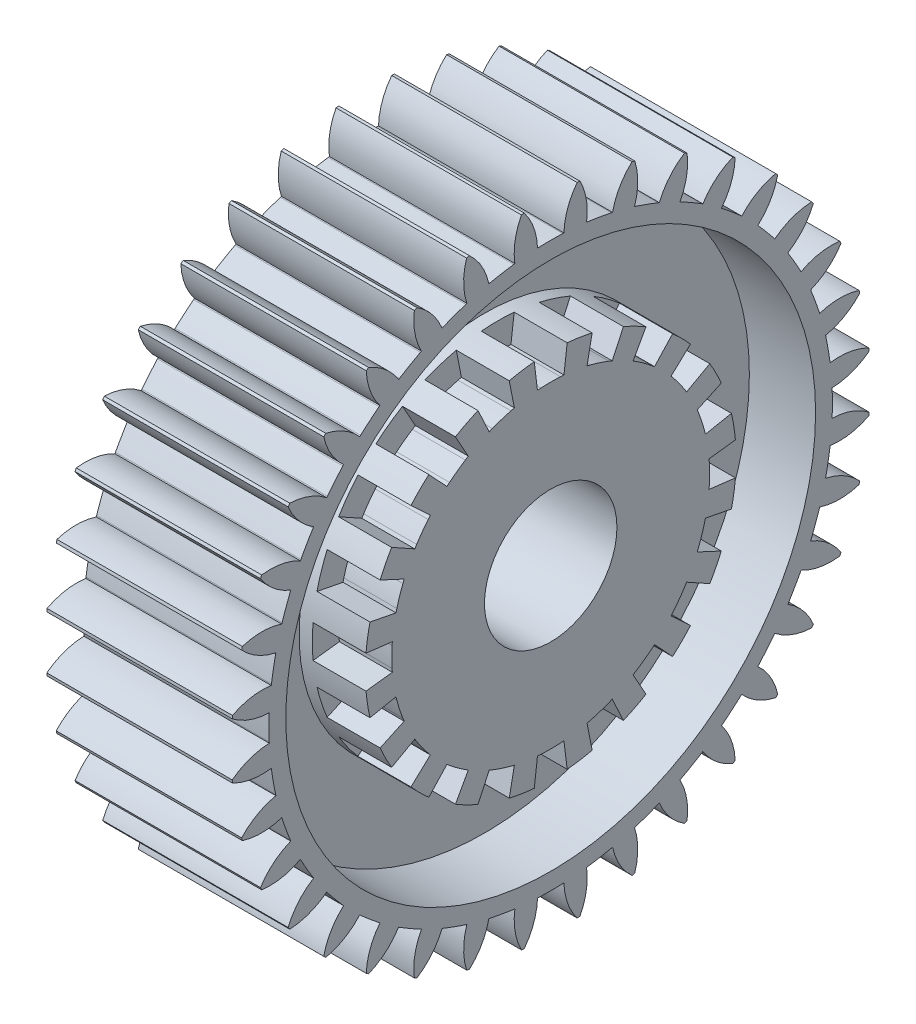
from build123d import *

# Parameters (mm, degrees)
SKETCH1_R                = 120.65
BOSS_EXTRUDE1_DEPTH      = 35
SKETCH2_R                = 25
CUT_EXTRUDE1_DEPTH       = 185.425716753
SKETCH3_R                = 100
SKETCH3_R_2              = 70
CUT_EXTRUDE2_DEPTH       = 25
CUT_EXTRUDE5_DEPTH       = 185.425716753
FILLET1_R                = 150
CIRPATTERN1_COUNT        = 36
FILLET1_OF_CIRPATTERN1_R = 150
CUT_EXTRUDE6_DEPTH       = 20
FILLET2_R                = 60
CIRPATTERN2_COUNT        = 20
FILLET2_OF_CIRPATTERN2_R = 60


with BuildPart() as part:
    # Sketch1 → Boss-Extrude1 (new, symmetric)
    with BuildSketch(Plane(origin=(0, 0, 0), x_dir=(0, 0, -1), z_dir=(1, 0, 0))):
        Circle(SKETCH1_R)
    extrude(amount=BOSS_EXTRUDE1_DEPTH, both=True)

    # Sketch2 → Cut-Extrude1 (cut, through all)
    with BuildSketch(Plane(origin=(35, 0, 0), x_dir=(0, 0, -1), z_dir=(1, 0, 0))):
        Circle(SKETCH2_R)
    extrude(amount=-CUT_EXTRUDE1_DEPTH, mode=Mode.SUBTRACT)

    # Sketch3 → Cut-Extrude2 (cut)
    with BuildSketch(Plane(origin=(35, 0, 0), x_dir=(0, 0, -1), z_dir=(1, 0, 0))):
        Circle(SKETCH3_R)
        Circle(SKETCH3_R_2, mode=Mode.SUBTRACT)
    extrude(amount=-CUT_EXTRUDE2_DEPTH, mode=Mode.SUBTRACT)

    # Sketch4 → Cut-Extrude5 (cut, through all)
    with BuildSketch(Plane(origin=(35, 0, 0), x_dir=(0, 0, -1), z_dir=(1, 0, 0))):
        with BuildLine():
            Line((0, 106.400245758), (-4.985, 106.248119983))
            ThreePointArc((-4.985, 106.248119983), (-6.379447104, 113.635112256), (-9.975, 120.236940559))
            Line((-9.975, 120.236940559), (0, 138.618178177))
            Line((0, 138.618178177), (9.975, 120.236940559))
            ThreePointArc((9.975, 120.236940559), (6.379447104, 113.635112256), (4.985, 106.248119983))
            Line((4.985, 106.248119983), (0, 106.400245758))
        make_face()
    cut_extrude5 = extrude(amount=-CUT_EXTRUDE5_DEPTH, mode=Mode.SUBTRACT)

    # Fillet1
    # the kernel refuses this fillet: 150 mm, written as the material it takes off along each edge
    with BuildSketch(Plane(origin=(46.443764402, 106.400245758, 0), x_dir=(0, -0.03050250535302991, -0.9995346903270483), z_dir=(-1, 0, 0))) as fillet1_piece_1:
        with BuildLine():
            CenterArc((FILLET1_R * 0.0305167050711, FILLET1_R), FILLET1_R, 266.50412812, 3.49587188)
            Line((-FILLET1_R * 0.0304599194134, FILLET1_R * 0.00186080566562), (0, 0))
            Line((0, 0), (FILLET1_R * 0.0305167050711, 0))
        make_face()
    extrude(amount=92.887528803, mode=Mode.SUBTRACT)

    # CirPattern1: Cut-Extrude5 ×36 about axis
    cirpattern1_axis = Axis((0, 0, 0), (1, 0, 0))
    for i in range(1, CIRPATTERN1_COUNT):
        add(cut_extrude5.rotate(cirpattern1_axis, i * 360 / CIRPATTERN1_COUNT), mode=Mode.SUBTRACT)

    # Fillet1 of CirPattern1
    # the kernel refuses this fillet: 150 mm, written as the material it takes off along each edge
    with BuildSketch(Plane(origin=(46.443764402, 104.783786945, 18.476208779), x_dir=(0, -0.2036064812481332, 0.979052807969904), z_dir=(-1, 0, 0)), Plane(origin=(46.443764402, 99.983525789, 36.391027304), x_dir=(0, -0.3705239772403646, 0.9288229014672182), z_dir=(-1, 0, 0)), Plane(origin=(46.443764402, 92.145315795, 53.200122879), x_dir=(0, -0.5261832896783177, 0.8503711811105216), z_dir=(-1, 0, 0)), Plane(origin=(46.443764402, 81.50731701, 68.392759641), x_dir=(0, -0.6658547891209932, 0.7460813627243599), z_dir=(-1, 0, 0)), Plane(origin=(46.443764402, 68.392759641, 81.50731701), x_dir=(0, -0.7852946277350107, 0.6191222396672009), z_dir=(-1, 0, 0)), Plane(origin=(46.443764402, 53.200122879, 92.145315795), x_dir=(0, -0.8808736864635514, 0.47335140064872827), z_dir=(-1, 0, 0)), Plane(origin=(46.443764402, 36.391027304, 99.983525789), x_dir=(0, -0.949687843972491, 0.31319801884890963), z_dir=(-1, 0, 0)), Plane(origin=(46.443764402, 18.476208779, 104.783786945), x_dir=(0, -0.989646216907564, 0.14352827373220522), z_dir=(-1, 0, 0)), Plane(origin=(46.443764402, 0, 106.400245758), x_dir=(0, -0.9995346903270483, -0.030502505353029917), z_dir=(-1, 0, 0)), Plane(origin=(46.443764402, -18.476208779, 104.783786945), x_dir=(0, -0.9790528079699027, -0.20360648124813913), z_dir=(-1, 0, 0)), Plane(origin=(46.443764402, -36.391027304, 99.983525789), x_dir=(0, -0.9288229014672182, -0.3705239772403646), z_dir=(-1, 0, 0)), Plane(origin=(46.443764402, -53.200122879, 92.145315795), x_dir=(0, -0.8503711811105207, -0.5261832896783193), z_dir=(-1, 0, 0)), Plane(origin=(46.443764402, -68.392759641, 81.50731701), x_dir=(0, -0.746081362724357, -0.6658547891209964), z_dir=(-1, 0, 0)), Plane(origin=(46.443764402, -81.50731701, 68.392759641), x_dir=(0, -0.6191222396672028, -0.7852946277350092), z_dir=(-1, 0, 0)), Plane(origin=(46.443764402, -92.145315795, 53.200122879), x_dir=(0, -0.4733514006487301, -0.8808736864635505), z_dir=(-1, 0, 0)), Plane(origin=(46.443764402, -99.983525789, 36.391027304), x_dir=(0, -0.31319801884890963, -0.949687843972491), z_dir=(-1, 0, 0)), Plane(origin=(46.443764402, -104.783786945, 18.476208779), x_dir=(0, -0.14352827373220864, -0.9896462169075634), z_dir=(-1, 0, 0)), Plane(origin=(46.443764402, -106.400245758, 0), x_dir=(0, 0.030502505353029917, -0.9995346903270483), z_dir=(-1, 0, 0)), Plane(origin=(46.443764402, -104.783786945, -18.476208779), x_dir=(0, 0.20360648124813913, -0.9790528079699027), z_dir=(-1, 0, 0)), Plane(origin=(46.443764402, -99.983525789, -36.391027304), x_dir=(0, 0.3705239772403657, -0.9288229014672178), z_dir=(-1, 0, 0)), Plane(origin=(46.443764402, -92.145315795, -53.200122879), x_dir=(0, 0.5261832896783177, -0.8503711811105216), z_dir=(-1, 0, 0)), Plane(origin=(46.443764402, -81.50731701, -68.392759641), x_dir=(0, 0.6658547891209933, -0.7460813627243597), z_dir=(-1, 0, 0)), Plane(origin=(46.443764402, -68.392759641, -81.50731701), x_dir=(0, 0.7852946277350092, -0.6191222396672028), z_dir=(-1, 0, 0)), Plane(origin=(46.443764402, -53.200122879, -92.145315795), x_dir=(0, 0.8808736864635501, -0.4733514006487307), z_dir=(-1, 0, 0)), Plane(origin=(46.443764402, -36.391027304, -99.983525789), x_dir=(0, 0.949687843972491, -0.31319801884890963), z_dir=(-1, 0, 0)), Plane(origin=(46.443764402, -18.476208779, -104.783786945), x_dir=(0, 0.989646216907563, -0.14352827373221164), z_dir=(-1, 0, 0)), Plane(origin=(46.443764402, 0, -106.400245758), x_dir=(0, 0.9995346903270483, 0.03050250535302991), z_dir=(-1, 0, 0)), Plane(origin=(46.443764402, 18.476208779, -104.783786945), x_dir=(0, 0.979052807969904, 0.2036064812481332), z_dir=(-1, 0, 0)), Plane(origin=(46.443764402, 36.391027304, -99.983525789), x_dir=(0, 0.9288229014672201, 0.37052397724035974), z_dir=(-1, 0, 0)), Plane(origin=(46.443764402, 53.200122879, -92.145315795), x_dir=(0, 0.8503711811105212, 0.5261832896783185), z_dir=(-1, 0, 0)), Plane(origin=(46.443764402, 68.392759641, -81.50731701), x_dir=(0, 0.7460813627243598, 0.665854789120993), z_dir=(-1, 0, 0)), Plane(origin=(46.443764402, 81.50731701, -68.392759641), x_dir=(0, 0.6191222396672047, 0.7852946277350077), z_dir=(-1, 0, 0)), Plane(origin=(46.443764402, 92.145315795, -53.200122879), x_dir=(0, 0.4733514006487301, 0.8808736864635505), z_dir=(-1, 0, 0)), Plane(origin=(46.443764402, 99.983525789, -36.391027304), x_dir=(0, 0.31319801884891, 0.9496878439724906), z_dir=(-1, 0, 0)), Plane(origin=(46.443764402, 104.783786945, -18.476208779), x_dir=(0, 0.1435282737322055, 0.9896462169075639), z_dir=(-1, 0, 0))) as fillet1_of_cirpattern1_piece_1:
        with BuildLine():
            CenterArc((FILLET1_OF_CIRPATTERN1_R * 0.0305167050711, -FILLET1_OF_CIRPATTERN1_R), FILLET1_OF_CIRPATTERN1_R, 90, 3.49587188)
            Line((-FILLET1_OF_CIRPATTERN1_R * 0.0304599194134, -FILLET1_OF_CIRPATTERN1_R * 0.00186080566562), (0, 0))
            Line((0, 0), (FILLET1_OF_CIRPATTERN1_R * 0.0305167050711, 0))
        make_face()
    extrude(amount=92.887528803, mode=Mode.SUBTRACT)

    # Sketch5 → Cut-Extrude6 (cut)
    with BuildSketch(Plane(origin=(35, 0, 0), x_dir=(0, 0, -1), z_dir=(1, 0, 0))):
        Polygon((-5, 59.791303716), (-9.571256192, 97.377400695), (9.571256192, 97.377400695), (5, 59.791303716), (0, 60.09927991), align=None)
    cut_extrude6 = extrude(amount=-CUT_EXTRUDE6_DEPTH, mode=Mode.SUBTRACT)

    # Fillet2
    fillet2_edges = [part.edges().sort_by_distance(p)[0] for p in [
        (25, 60.09927991, 0),
    ]]
    fillet(fillet2_edges, radius=FILLET2_R)

    # CirPattern2: Cut-Extrude6 ×20 about axis
    cirpattern2_axis = Axis((0, 0, 0), (1, 0, 0))
    for i in range(1, CIRPATTERN2_COUNT):
        add(cut_extrude6.rotate(cirpattern2_axis, i * 360 / CIRPATTERN2_COUNT), mode=Mode.SUBTRACT)

    # Fillet2 of CirPattern2
    fillet2_of_cirpattern2_edges = [part.edges().sort_by_distance(p)[0] for p in [
        (25, 57.157811783, 18.571698842),
        (25, 48.621338797, 35.325470405),
        (25, 35.325470405, 48.621338797),
        (25, 18.571698842, 57.157811783),
        (25, 0, 60.09927991),
        (25, -18.571698842, 57.157811783),
        (25, -35.325470405, 48.621338797),
        (25, -48.621338797, 35.325470405),
        (25, -57.157811783, 18.571698842),
        (25, -60.09927991, 0),
        (25, -57.157811783, -18.571698842),
        (25, -48.621338797, -35.325470405),
        (25, -35.325470405, -48.621338797),
        (25, -18.571698842, -57.157811783),
        (25, 0, -60.09927991),
        (25, 18.571698842, -57.157811783),
        (25, 35.325470405, -48.621338797),
        (25, 48.621338797, -35.325470405),
        (25, 57.157811783, -18.571698842),
    ]]
    fillet(fillet2_of_cirpattern2_edges, radius=FILLET2_OF_CIRPATTERN2_R)


solid = part.part
